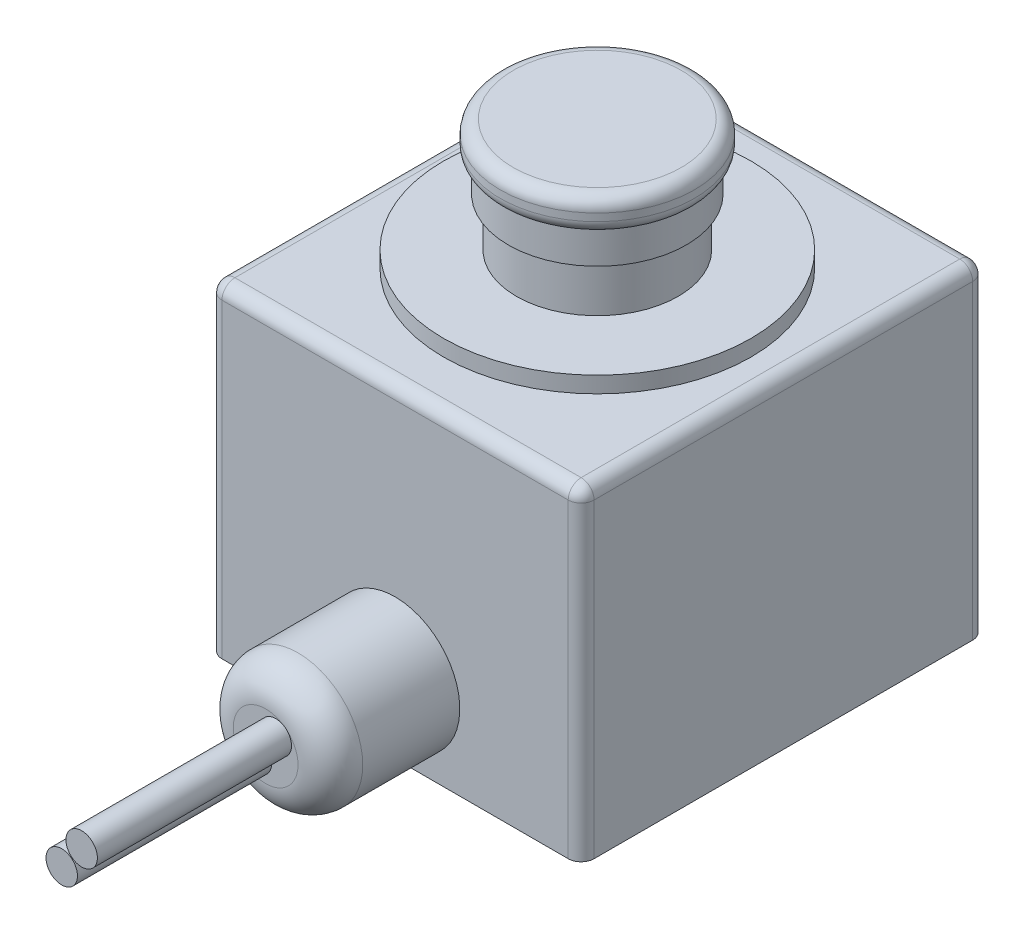
from build123d import *

# Parameters (mm, degrees)
SKETCH1_W           = 73.025
SKETCH1_H           = 79.375
BOSS_EXTRUDE1_DEPTH = 63.5
SKETCH2_R           = 15.875
BOSS_EXTRUDE2_DEPTH = 12.7
SKETCH3_R           = 30.1625
BOSS_EXTRUDE3_DEPTH = 3.175
SKETCH4_R           = 17.4625
BOSS_EXTRUDE4_DEPTH = 6.35
SKETCH5_R           = 19.05
BOSS_EXTRUDE5_DEPTH = 6.35
FILLET1_R           = 2.54
FILLET2_R           = 2.54
FILLET5_R           = 2.54
SKETCH7_R           = 12.7
BOSS_EXTRUDE7_DEPTH = 25.4
FILLET6_R           = 6.35
SKETCH8_R           = 3.086351458
BOSS_EXTRUDE8_DEPTH = 38.1


with BuildPart() as part:
    # Sketch1 → Boss-Extrude1 (new body)
    with BuildSketch(Plane(origin=(0, 0, 0), x_dir=(1, 0, 0), z_dir=(0, 1, 0))):
        with Locations((36.5125, 39.6875)):
            Rectangle(SKETCH1_W, SKETCH1_H)
    extrude(amount=BOSS_EXTRUDE1_DEPTH)

    # Sketch2 → Boss-Extrude2 (add)
    with BuildSketch(Plane(origin=(0, 63.5, 0), x_dir=(1, 0, 0), z_dir=(0, 1, 0))):
        with Locations(Location((36.5125, 39.6875, 0), (0, 0, 270))):
            Circle(SKETCH2_R)
    extrude(amount=BOSS_EXTRUDE2_DEPTH)

    # Sketch3 → Boss-Extrude3 (add)
    with BuildSketch(Plane(origin=(0, 63.5, 0), x_dir=(1, 0, 0), z_dir=(0, 1, 0))):
        with Locations(Location((36.5125, 39.6875, 0), (0, 0, 90))):
            Circle(SKETCH3_R)
    extrude(amount=BOSS_EXTRUDE3_DEPTH)

    # Sketch4 → Boss-Extrude4 (add)
    with BuildSketch(Plane(origin=(0, 76.2, 0), x_dir=(1, 0, 0), z_dir=(0, 1, 0))):
        with Locations(Location((36.5125, 39.6875, 0), (0, 0, 270))):
            Circle(SKETCH4_R)
    extrude(amount=BOSS_EXTRUDE4_DEPTH)

    # Sketch5 → Boss-Extrude5 (add)
    with BuildSketch(Plane(origin=(0, 82.55, 0), x_dir=(1, 0, 0), z_dir=(0, 1, 0))):
        with Locations(Location((36.5125, 39.6875, 0), (0, 0, 270))):
            Circle(SKETCH5_R)
    extrude(amount=BOSS_EXTRUDE5_DEPTH)

    # Fillet1
    # the kernel refuses this fillet: 2.54 mm, written as the material it takes off along each edge
    with BuildSketch(Plane(origin=(36.5125, 82.55, -39.6875), x_dir=(0, 0, 1), z_dir=(-1, 0, 0))) as fillet1_piece_1:
        with BuildLine():
            CenterArc((16.51, 2.35464302), FILLET1_R, 292.024312837, 67.975687163)
            Line((17.4625, 0), (17.48155, -0.04709286))
            ThreePointArc((17.48155, -0.04709286), (18.25625, -0.0508), (19.05, -0.0508))
            Line((19.05, -0.0508), (19.1008, 0))
            Line((19.1008, 0), (19.1008, 2.35464302))
            Line((19.1008, 2.35464302), (19.05, 2.35464302))
        make_face()
    revolve(axis=Axis((36.5125, 82.55, -39.6875), (0, 1, 0)), mode=Mode.SUBTRACT)
    with BuildSketch(Plane(origin=(36.5125, 88.9, -39.6875), x_dir=(0, 0, 1), z_dir=(-1, 0, 0))) as fillet1_piece_2:
        with BuildLine():
            CenterArc((19.05 - FILLET1_R, -FILLET1_R), FILLET1_R, 0, 90)
            Line((19.05 - FILLET1_R, 0), (19.05 - FILLET1_R, FILLET1_R * 0.02))
            Line((19.05 - FILLET1_R, FILLET1_R * 0.02), (19.05 + FILLET1_R * 0.02, FILLET1_R * 0.02))
            Line((19.05 + FILLET1_R * 0.02, FILLET1_R * 0.02), (19.05 + FILLET1_R * 0.02, -FILLET1_R))
            Line((19.05 + FILLET1_R * 0.02, -FILLET1_R), (19.05, -FILLET1_R))
        make_face()
    revolve(axis=Axis((36.5125, 88.9, -39.6875), (0, 1, 0)), mode=Mode.SUBTRACT)

    # Fillet2
    fillet2_edges = [part.edges().sort_by_distance(p)[0] for p in [
        (0, 31.75, 0),
        (73.025, 31.75, 0),
        (73.025, 31.75, -79.375),
        (0, 31.75, -79.375),
    ]]
    fillet(fillet2_edges, radius=FILLET2_R)

    # Fillet5
    fillet5_edges = [part.edges().sort_by_distance(p)[0] for p in [
        (36.5125, 63.5, -79.375),
        (73.025, 63.5, -39.6875),
        (0, 63.5, -39.6875),
        (36.5125, 63.5, 0),
        (0.743948776, 63.5, -78.631051224),
        (0.743948776, 63.5, -0.743948776),
        (72.281051224, 63.5, -0.743948776),
        (72.281051224, 63.5, -78.631051224),
    ]]
    fillet(fillet5_edges, radius=FILLET5_R)

    # Sketch7 → Boss-Extrude7 (add)
    with BuildSketch(Plane.XY):
        with Locations(Location((36.5125, 14.834220105, 0), (0, 0, 180))):
            Circle(SKETCH7_R)
    extrude(amount=BOSS_EXTRUDE7_DEPTH)

    # Fillet6
    fillet6_edges = [part.edges().sort_by_distance(p)[0] for p in [
        (49.2125, 14.834220105, 25.4),
    ]]
    fillet(fillet6_edges, radius=FILLET6_R)

    # Sketch8 → Boss-Extrude8 (add)
    with BuildSketch(Plane.XY.offset(25.4)):
        with Locations(Location((38.506076801, 17.440379035, 0), (0, 0, 61.105176003))):
            Circle(SKETCH8_R)
        with Locations(Location((34.596139796, 12.429051324, 0), (0, 0, 180))):
            Circle(SKETCH8_R)
    extrude(amount=BOSS_EXTRUDE8_DEPTH)


solid = part.part
